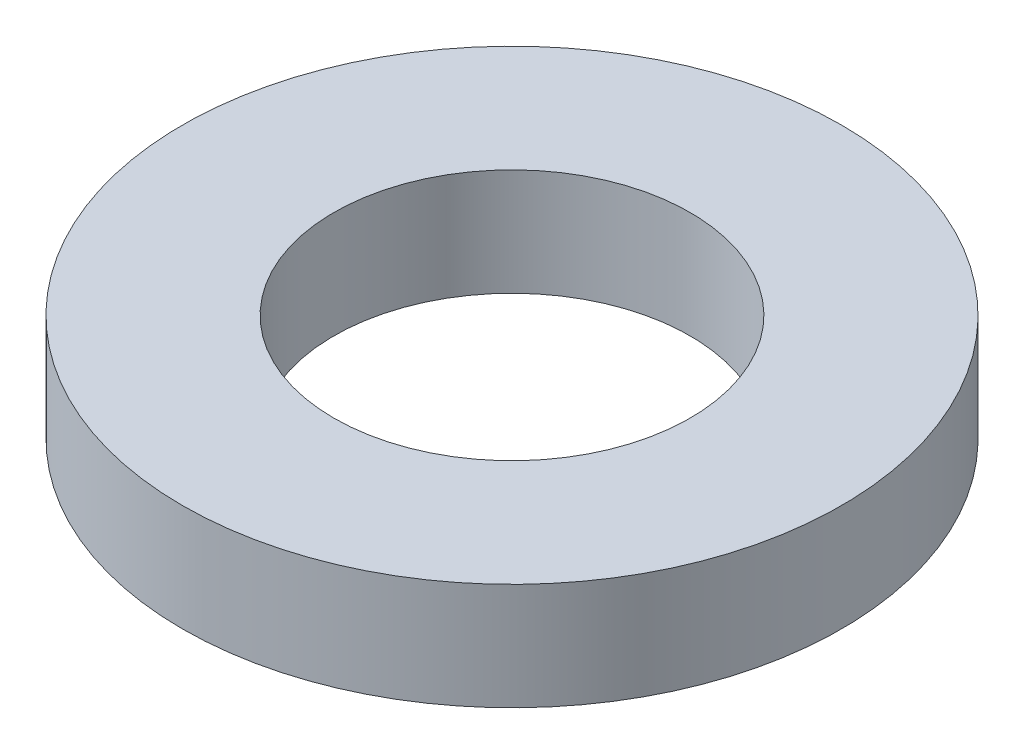
from build123d import *

# Parameters (mm, degrees)
SKETCH1_R           = 92.5
BOSS_EXTRUDE1_DEPTH = 30
SKETCH2_R           = 50
CUT_EXTRUDE1_DEPTH  = 135.210655315


with BuildPart() as part:
    # Sketch1 → Boss-Extrude1 (new body)
    with BuildSketch(Plane(origin=(0, 0, 0), x_dir=(1, 0, 0), z_dir=(0, 1, 0))):
        Circle(SKETCH1_R)
    extrude(amount=BOSS_EXTRUDE1_DEPTH)

    # Sketch2 → Cut-Extrude1 (cut, through all)
    with BuildSketch(Plane(origin=(0, 0, 0), x_dir=(1, 0, 0), z_dir=(0, 1, 0))):
        Circle(SKETCH2_R)
    extrude(amount=CUT_EXTRUDE1_DEPTH, mode=Mode.SUBTRACT)


solid = part.part
